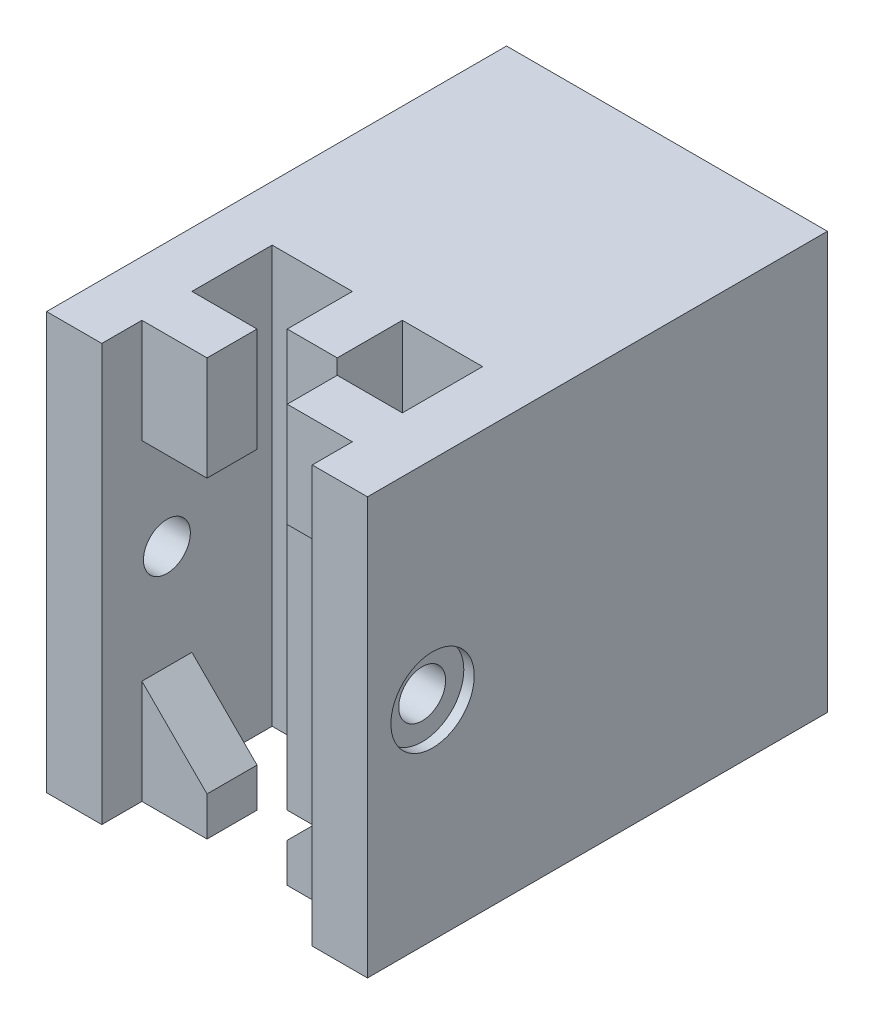
from build123d import *

# Parameters (mm, degrees)
BOSS_EXTRU_1_DEPTH                                = 20
CHAMBRAGE_POUR_VIS_SIX_PANS_CREUX_M41_D           = 4.5
CHAMBRAGE_POUR_VIS_SIX_PANS_CREUX_M41_DEPTH       = 11.55
CHAMBRAGE_POUR_VIS_SIX_PANS_CREUX_M41_CBORE_D     = 8
CHAMBRAGE_POUR_VIS_SIX_PANS_CREUX_M41_CBORE_DEPTH = 1
ESQUISSE6_W                                       = 20.2
ESQUISSE6_H                                       = 20
ENL_V_MAT_EXTRU_1_DEPTH                           = 3
ESQUISSE14_W                                      = 30.8
ESQUISSE14_H                                      = 2.5
BOSS_EXTRU_3_DEPTH                                = 40
CHANFREIN1_SIZE                                   = 6.25
ESQUISSE15_W                                      = 30.8
ESQUISSE15_H                                      = 40
BOSS_EXTRU_4_DEPTH                                = 20
ENL_V_MAT_EXTRU_2_DEPTH                           = 12


with BuildPart() as part:
    # Base → Boss.-Extru.1 (new, symmetric)
    with BuildSketch(Plane(origin=(0, 0, 0), x_dir=(1, 0, 0), z_dir=(0, 1, 0))):
        Polygon((-3.85, -2.4), (-3.85, 2.4), (-10.1, 2.4), (-10.1, 10.1), (-2.4, 10.1), (-2.4, 3.85), (2.4, 3.85), (2.4, 10.1), (10.1, 10.1), (10.1, 2.4), (3.85, 2.4), (3.85, -2.4), (10.1, -2.4), (10.1, -6.25), (15.4, -6.25), (15.4, 15.4), (-15.4, 15.4), (-15.4, -6.25), (-10.1, -6.25), (-10.1, -2.4), align=None)
    extrude(amount=BOSS_EXTRU_1_DEPTH, both=True)

    # Chambrage pour vis à six pans creux M41
    with Locations(Plane(origin=(15.4, 0, 0), x_dir=(0, 0, -1), z_dir=(1, 0, 0))):
        with Locations((0, 0)):
            chambrage_pour_vis_six_pans_creux_m41 = CounterBoreHole(CHAMBRAGE_POUR_VIS_SIX_PANS_CREUX_M41_D / 2, CHAMBRAGE_POUR_VIS_SIX_PANS_CREUX_M41_CBORE_D / 2, CHAMBRAGE_POUR_VIS_SIX_PANS_CREUX_M41_CBORE_DEPTH, depth=CHAMBRAGE_POUR_VIS_SIX_PANS_CREUX_M41_DEPTH)

    # Symétrie1: Chambrage pour vis à six pans creux M41 across plane
    add(chambrage_pour_vis_six_pans_creux_m41.mirror(Plane(origin=(0, 0, 0), x_dir=(0, 0, 1), z_dir=(1, 0, 0))), mode=Mode.SUBTRACT)

    # Esquisse6 → Enlèv. mat.-Extru.1 (cut, symmetric)
    with BuildSketch(Plane.XY):
        Rectangle(ESQUISSE6_W, ESQUISSE6_H)
    extrude(amount=ENL_V_MAT_EXTRU_1_DEPTH, both=True, mode=Mode.SUBTRACT)

    # Esquisse14 → Boss.-Extru.3 (add)
    with BuildSketch(Plane.XZ.offset(20)):
        with Locations((0, -16.65)):
            Rectangle(ESQUISSE14_W, ESQUISSE14_H)
    extrude(amount=-BOSS_EXTRU_3_DEPTH)

    # Chanfrein1
    chanfrein1_edges = [part.edges().sort_by_distance(p)[0] for p in [
        (3.85, -10, 0),
        (-3.85, -10, 0),
    ]]
    chamfer(chanfrein1_edges, length=CHANFREIN1_SIZE - 0.0001)  # a hair under: the kernel refuses the full size

    # Esquisse15 → Boss.-Extru.4 (add)
    with BuildSketch(Plane(origin=(0, 0, -17.9), x_dir=(-1, 0, 0), z_dir=(0, 0, -1))):
        Rectangle(ESQUISSE15_W, ESQUISSE15_H)
    extrude(amount=BOSS_EXTRU_4_DEPTH)

    # Esquisse17 → Enlèv. mat.-Extru.2 (cut)
    with BuildSketch(Plane.ZY.offset(15.4)):
        Polygon((-37.9, -8), (-37.9, 8), (-17.9, 15), (-17.9, -15), align=None)
    extrude(amount=-ENL_V_MAT_EXTRU_2_DEPTH, mode=Mode.SUBTRACT)


solid = part.part
